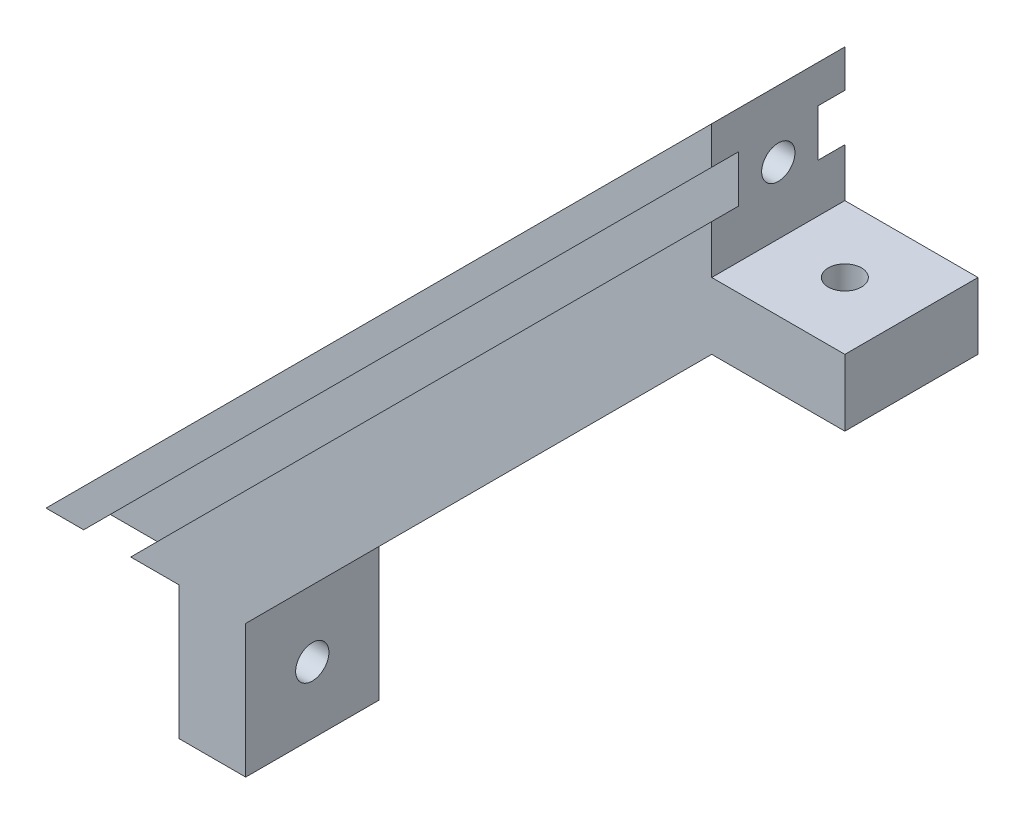
from build123d import *

# Parameters (mm, degrees)
MAIN_DEPTH         = 5
SKETCH2_R          = 1.25
FIXHOLE1_DEPTH     = 62.23724357
SKETCH3_R          = 1.25
FIXHOLE2_DEPTH     = 62.23724357
WINDOWSLOT1_DEPTH  = 2
SKETCH6_R          = 1.25
CUT_EXTRUDE2_DEPTH = 3
LPATTERN1_COUNT    = 5
LPATTERN1_PITCH    = 10


with BuildPart() as part:
    # Sketch1 → Main (new, symmetric)
    with BuildSketch(Plane.XY):
        Polygon((-25, -25), (25, 25), (25, 15), (35, 15), (35, 10), (25, 10), (-10, -25), (-10, -35), (-15, -35), (-15, -25), align=None)
    extrude(amount=MAIN_DEPTH, both=True)

    # Sketch2 → FixHole1 (cut, through all)
    with BuildSketch(Plane(origin=(25, 0, 0), x_dir=(0, 0, -1), z_dir=(1, 0, 0))):
        with Locations((0, -30)):
            Circle(SKETCH2_R)
        with Locations((0, 20)):
            Circle(SKETCH2_R)
    extrude(amount=-FIXHOLE1_DEPTH, mode=Mode.SUBTRACT)

    # Sketch3 → FixHole2 (cut, through all)
    with BuildSketch(Plane(origin=(0, -25, 0), x_dir=(-1, 0, 0), z_dir=(0, -1, 0))):
        with Locations((20, 0)):
            Circle(SKETCH3_R)
        with Locations((-30, 0)):
            Circle(SKETCH3_R)
    extrude(amount=-FIXHOLE2_DEPTH, mode=Mode.SUBTRACT)

    # Sketch4 → WindowSlot1 (cut)
    with BuildSketch(Plane.XY.offset(5)):
        Polygon((25, 22.171572875), (-22.171572875, -25), (-18.636038969, -25), (25, 18.636038969), align=None)
    windowslot1 = extrude(amount=-WINDOWSLOT1_DEPTH, mode=Mode.SUBTRACT)

    # Mirror1: WindowSlot1 across plane
    add(windowslot1.mirror(Plane.XY), mode=Mode.SUBTRACT)

    # Sketch6 → Cut-Extrude2 (cut)
    with BuildSketch(Plane(origin=(7.5, -7.5, 0), x_dir=(0, 0, 1), z_dir=(-0.7071067811865489, 0.7071067811865461, 0))):
        with Locations((0, 20)):
            Circle(SKETCH6_R)
    cut_extrude2 = extrude(amount=CUT_EXTRUDE2_DEPTH, mode=Mode.SUBTRACT)

    # LPattern1: Cut-Extrude2 ×5
    with Locations(*[Vector(-0.7071067811865462, -0.7071067811865489, 0) * (i * LPATTERN1_PITCH) for i in range(1, LPATTERN1_COUNT)]):
        add(cut_extrude2, mode=Mode.SUBTRACT)


solid = part.part
